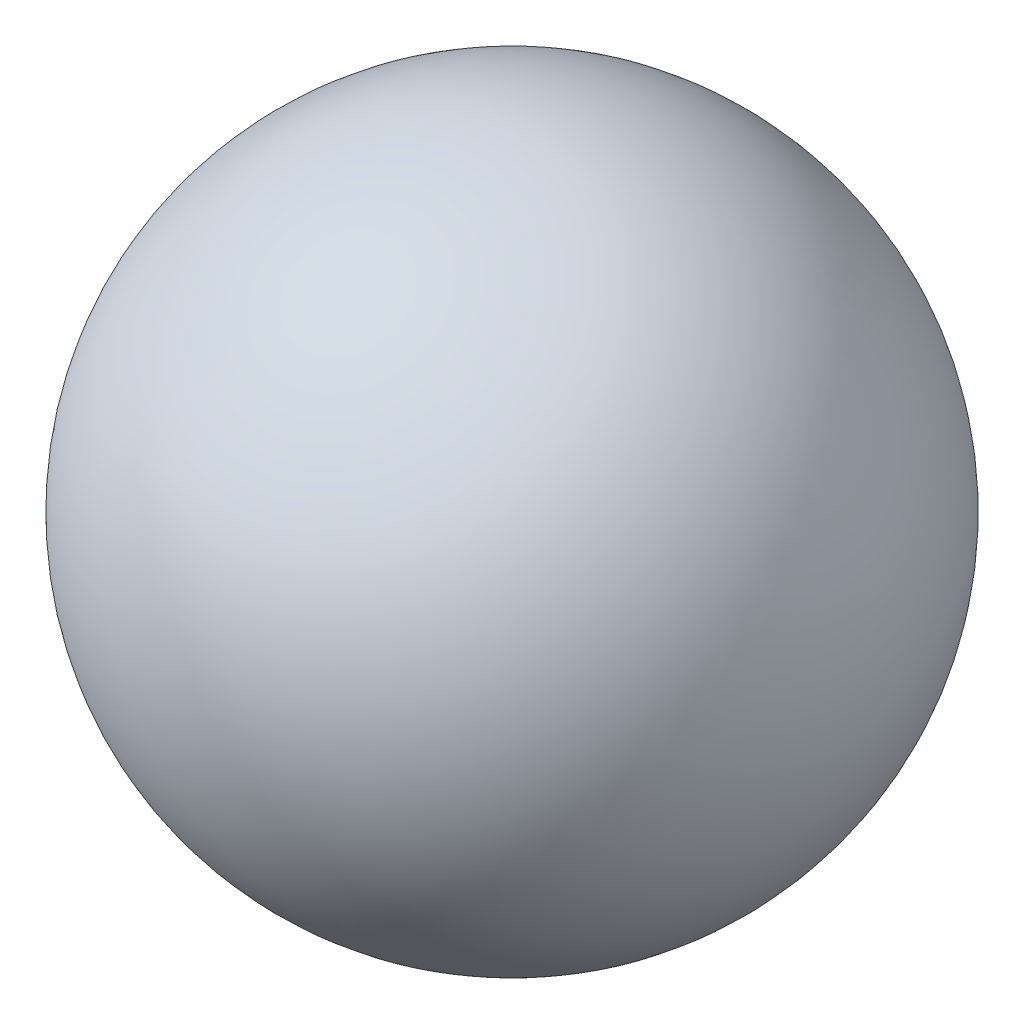
from build123d import *


with BuildPart() as part:
    # Sketch1 → Revolve1 (revolve)
    with BuildSketch(Plane.XY):
        with BuildLine():
            Line((0, 158.75), (0, -158.75))
            ThreePointArc((0, -158.75), (158.75, 0), (0, 158.75))
        make_face()
    revolve(axis=Axis((0, 158.75, 0), (0, -1, 0)))


solid = part.part
